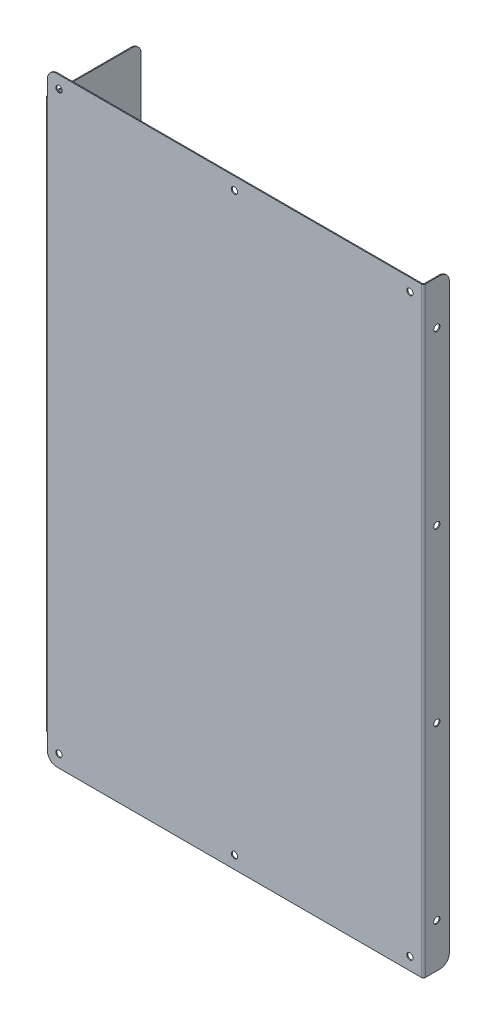
from build123d import *

# Parameters (mm, degrees)
BASE_FLANGE1_DEPTH            = 480
CUT_EXTRUDE1_START            = -3
SKETCH6_W                     = 170
SKETCH6_H                     = 41
CUT_EXTRUDE1_DEPTH            = 789.949107767
M5_CLEARANCE_HOLE1_D          = 5.8
FILLET1_R                     = 15
M8_CLEARANCE_HOLE1_AT_2_COUNT = 2
M8_CLEARANCE_HOLE1_AT_2_PITCH = 280.5
M8_CLEARANCE_HOLE1_AT_3_COUNT = 2
M8_CLEARANCE_HOLE1_AT_3_PITCH = 561
M8_CLEARANCE_HOLE2_D          = 10
M8_CLEARANCE_HOLE2_DEPTH      = 8.995696905
M8_CLEARANCE_HOLE2_TIP        = 3.004303095
M8_CLEARANCE_HOLE3_D          = 10
M8_CLEARANCE_HOLE3_DEPTH      = 8.995696905
M8_CLEARANCE_HOLE3_TIP        = 3.004303095


# Sheet-metal steps are written as plain solids
with BuildPart() as part:
    # Sketch1 → Base-Flange1 (new, symmetric)
    with BuildSketch(Plane(origin=(0, 0, 0), x_dir=(1, 0, 0), z_dir=(0, 1, 0))):
        with BuildLine():
            Line((300.5, 40), (300.5, 1.5))
            ThreePointArc((300.5, 1.5), (300.060660172, 0.439339828), (299, 0))
            Line((299, 0), (-299, 0))
            ThreePointArc((-299, 0), (-300.060660172, 0.439339828), (-300.5, 1.5))
            Line((-300.5, 1.5), (-300.5, 150))
            Line((-300.5, 150), (-302, 150))
            Line((-302, 150), (-302, 1.5))
            ThreePointArc((-302, 1.5), (-301.121320344, -0.621320344), (-299, -1.5))
            Line((-299, -1.5), (299, -1.5))
            ThreePointArc((299, -1.5), (301.121320344, -0.621320344), (302, 1.5))
            Line((302, 1.5), (302, 40))
            Line((302, 40), (300.5, 40))
        make_face()
    extrude(amount=BASE_FLANGE1_DEPTH, both=True)

    # Sketch6 → Cut-Extrude1 (cut)
    with BuildSketch(Plane.ZY.offset(302).offset(CUT_EXTRUDE1_START)):
        with Locations((-73.5, 459.5)):
            Rectangle(SKETCH6_W, SKETCH6_H)
    cut_extrude1 = extrude(amount=CUT_EXTRUDE1_DEPTH, mode=Mode.SUBTRACT)

    # Mirror1: Cut-Extrude1 across plane
    add(cut_extrude1.mirror(Plane.ZX), mode=Mode.SUBTRACT)

    # M5 Clearance Hole1 (through all)
    with Locations(Plane.ZY.offset(302)):
        with Locations((-75.75, -379), (-75.75, -189.5), (-75.75, 0), (-75.75, 189.5), (-75.75, 379)):
            Hole(M5_CLEARANCE_HOLE1_D / 2)

    # Fillet1
    fillet1_edges = [part.edges().sort_by_distance(p)[0] for p in [
        (301.25, -480, -40),
        (-299, -480, 0.75),
        (-299, 480, 0.75),
        (301.25, 480, -40),
        (-301.25, 439, -150),
        (-301.25, -439, -150),
    ]]
    fillet(fillet1_edges, radius=FILLET1_R)

    # Sketch10 → M8 Clearance Hole1 (revolve, cut)
    with BuildSketch(Plane(origin=(-280.5, 460, 1.5), x_dir=(0, -1, 0), z_dir=(1, 0, 0))):
        Polygon((0, 0), (0, 12), (5, 8.995696905), (5, 0), align=None)
    m8_clearance_hole1 = revolve(axis=Axis((-280.5, 460, 7.85), (0, 0, -1)), mode=Mode.SUBTRACT)

    # M8 Clearance Hole1 at 2: M8 Clearance Hole1 ×2
    with Locations(*[(i * M8_CLEARANCE_HOLE1_AT_2_PITCH, 0, 0) for i in range(1, M8_CLEARANCE_HOLE1_AT_2_COUNT)]):
        add(m8_clearance_hole1, mode=Mode.SUBTRACT)

    # M8 Clearance Hole1 at 3: M8 Clearance Hole1 ×2
    with Locations(*[(i * M8_CLEARANCE_HOLE1_AT_3_PITCH, 0, 0) for i in range(1, M8_CLEARANCE_HOLE1_AT_3_COUNT)]):
        add(m8_clearance_hole1, mode=Mode.SUBTRACT)

    # Mirror2: M8 Clearance Hole1 across plane
    add(m8_clearance_hole1.mirror(Plane.ZX), mode=Mode.SUBTRACT)

    # Mirror2 copy 1 sketch → Mirror2 copy 1 (revolve, cut)
    with BuildSketch(Plane(origin=(0, -460, 1.5), x_dir=(0, 1, 0), z_dir=(1, 0, 0))):
        Polygon((0, 0), (0, -12), (5, -8.995696905), (5, 0), align=None)
    revolve(axis=Axis((0, -460, 7.85), (0, 0, 1)), mode=Mode.SUBTRACT)

    # Mirror2 copy 2 sketch → Mirror2 copy 2 (revolve, cut)
    with BuildSketch(Plane(origin=(280.5, -460, 1.5), x_dir=(0, 1, 0), z_dir=(1, 0, 0))):
        Polygon((0, 0), (0, -12), (5, -8.995696905), (5, 0), align=None)
    revolve(axis=Axis((280.5, -460, 7.85), (0, 0, 1)), mode=Mode.SUBTRACT)

    # M8 Clearance Hole2
    with Locations(Plane(origin=(302, 0, 0), x_dir=(0, 0, -1), z_dir=(1, 0, 0))):
        with Locations((20, 410), (20, 136.666666667), (20, -136.666666667), (20, -410)):
            Hole(M8_CLEARANCE_HOLE2_D / 2, depth=M8_CLEARANCE_HOLE2_DEPTH)
            with Locations((0, 0, -(M8_CLEARANCE_HOLE2_DEPTH + M8_CLEARANCE_HOLE2_TIP / 2))):  # 118° drill point
                Cone(0, M8_CLEARANCE_HOLE2_D / 2, M8_CLEARANCE_HOLE2_TIP, mode=Mode.SUBTRACT)

    # M8 Clearance Hole3
    with Locations(Plane.ZY.offset(302)):
        with Locations((-20, 369), (-20, 0), (-20, -369)):
            Hole(M8_CLEARANCE_HOLE3_D / 2, depth=M8_CLEARANCE_HOLE3_DEPTH)
            with Locations((0, 0, -(M8_CLEARANCE_HOLE3_DEPTH + M8_CLEARANCE_HOLE3_TIP / 2))):  # 118° drill point
                Cone(0, M8_CLEARANCE_HOLE3_D / 2, M8_CLEARANCE_HOLE3_TIP, mode=Mode.SUBTRACT)


solid = part.part
